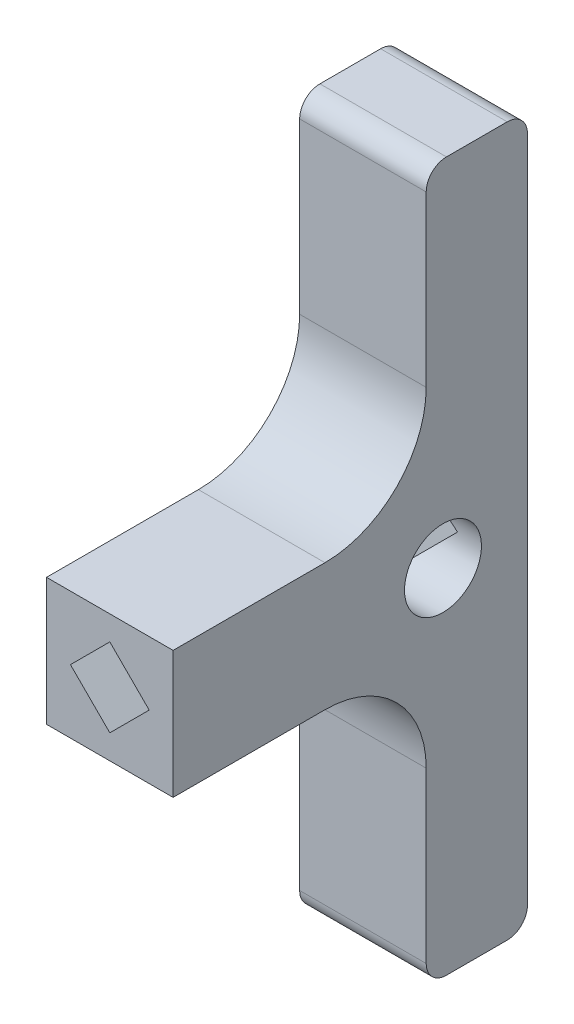
from build123d import *

# Parameters (mm, degrees)
ESQUISSE1_W             = 12.5
ESQUISSE1_H             = 70
BOSS_EXTRU_1_DEPTH      = 10
ESQUISSE2_W             = 12.5
ESQUISSE2_H             = 12.576917286
BOSS_EXTRU_2_DEPTH      = 35
ENL_V_MAT_EXTRU_1_DEPTH = 40
CONG_1_R                = 10
CONG_3_R                = 2
D_GAGEMENT_M71_D        = 7.6
D_GAGEMENT_M71_DEPTH    = 12.5
D_GAGEMENT_M71_TIP      = 2.283270352


with BuildPart() as part:
    # Esquisse1 → Boss.-Extru.1 (new body)
    with BuildSketch(Plane.XY):
        Rectangle(ESQUISSE1_W, ESQUISSE1_H)
    extrude(amount=BOSS_EXTRU_1_DEPTH)

    # Esquisse2 → Boss.-Extru.2 (add)
    with BuildSketch(Plane(origin=(0, 0, 0), x_dir=(-1, 0, 0), z_dir=(0, 0, -1))):
        Rectangle(ESQUISSE2_W, ESQUISSE2_H)
    extrude(amount=-BOSS_EXTRU_2_DEPTH)

    # Esquisse3 → Enlèv. mat.-Extru.1 (cut)
    with BuildSketch(Plane(origin=(0, 0, 0), x_dir=(-1, 0, 0), z_dir=(0, 0, -1))):
        Polygon((-3.889087297, 0), (0, 3.889087297), (3.889087297, 0), (0, -3.889087297), align=None)
    extrude(amount=-ENL_V_MAT_EXTRU_1_DEPTH, mode=Mode.SUBTRACT)

    # Congé1
    cong_1_edges = [part.edges().sort_by_distance(p)[0] for p in [
        (0, 6.288458643, 10),
        (0, -6.288458643, 10),
    ]]
    fillet(cong_1_edges, radius=CONG_1_R)

    # Congé3
    cong_3_edges = [part.edges().sort_by_distance(p)[0] for p in [
        (0, -35, 10),
        (0, -35, 0),
        (0, 35, 0),
        (0, 35, 10),
    ]]
    fillet(cong_3_edges, radius=CONG_3_R)

    # Dégagement M71
    with Locations(Plane.ZY.offset(6.25)):
        with Locations((8.344762473, 0)):
            Hole(D_GAGEMENT_M71_D / 2, depth=D_GAGEMENT_M71_DEPTH)
            with Locations((0, 0, -(D_GAGEMENT_M71_DEPTH + D_GAGEMENT_M71_TIP / 2))):  # 118° drill point
                Cone(0, D_GAGEMENT_M71_D / 2, D_GAGEMENT_M71_TIP, mode=Mode.SUBTRACT)


solid = part.part
